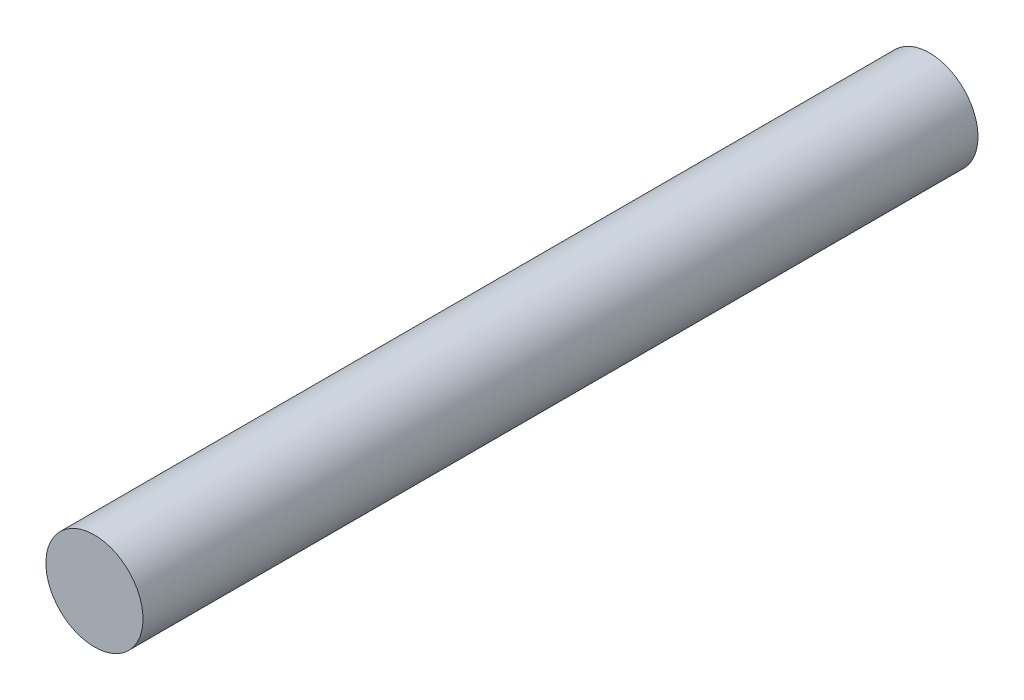
from build123d import *

# Parameters (mm, degrees)
BOSS_EXTRUDE1_START     = -109.223144111
BOSS_EXTRUDE1_OUTLINE_R = 6.35
BOSS_EXTRUDE1_DEPTH     = 109.223144111


# Read off the part's stored shape, not the designer's step: Boss-Extrude1
with BuildPart() as part:
    # Boss-Extrude1 outline → Boss-Extrude1 (new body)
    with BuildSketch(Plane.XY.offset(89.157144111).offset(BOSS_EXTRUDE1_START)):
        Circle(BOSS_EXTRUDE1_OUTLINE_R)
    extrude(amount=BOSS_EXTRUDE1_DEPTH)


solid = part.part
